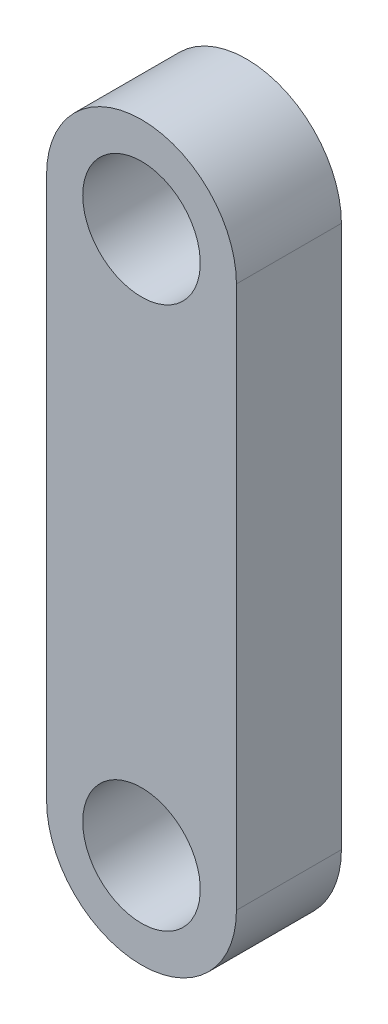
from build123d import *

# Parameters (mm, degrees)
BOSS_EXTRUDE1_DEPTH = 6
SKETCH1_3_R         = 3.358333333
CUT_EXTRUDE1_DEPTH  = 16


with BuildPart() as part:
    # Sketch1 → Boss-Extrude1 (new body)
    with BuildSketch(Plane.XY):
        with BuildLine():
            Line((-5.425, 0), (-5.425, -31))
            ThreePointArc((-5.425, -31), (0, -36.425), (5.425, -31))
            Line((5.425, -31), (5.425, 0))
            ThreePointArc((5.425, 0), (0, 5.425), (-5.425, 0))
        make_face()
    extrude(amount=BOSS_EXTRUDE1_DEPTH)

    # Sketch1<3> → Cut-Extrude1 (cut)
    with BuildSketch(Plane.XY):
        Circle(SKETCH1_3_R)
        with Locations((0, -31)):
            Circle(SKETCH1_3_R)
    extrude(amount=CUT_EXTRUDE1_DEPTH, mode=Mode.SUBTRACT)


solid = part.part
